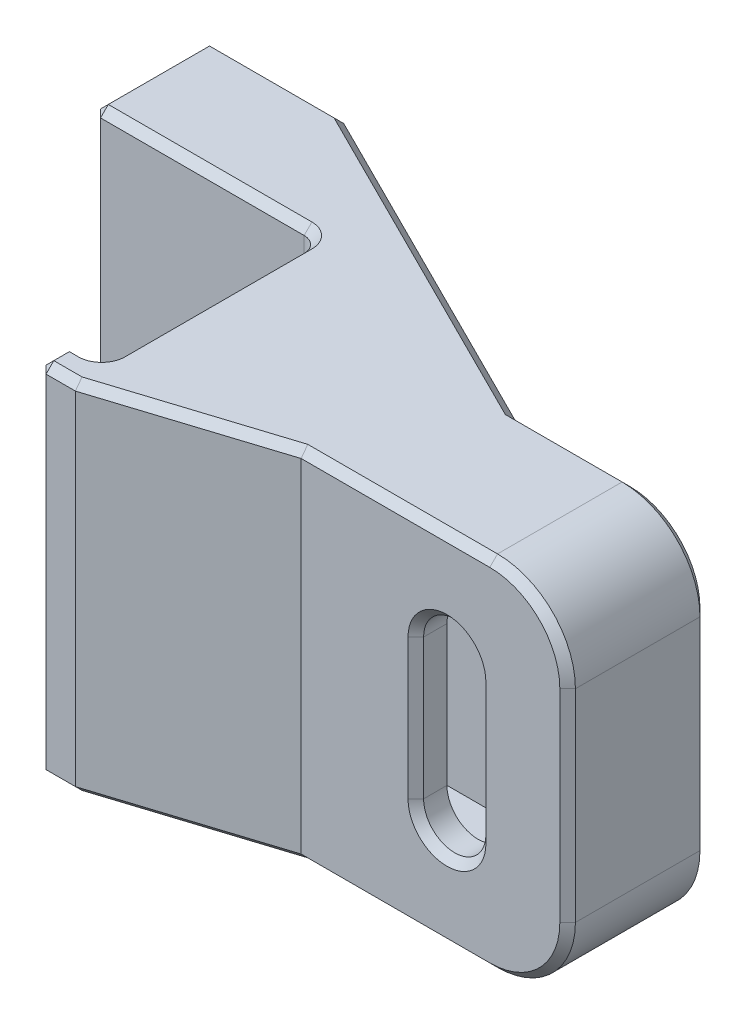
from build123d import *

# Parameters (mm, degrees)
CREATE_INTERNAL_GEOMETRY_DEPTH = 38
CUT_SHACKLE_HOLE_DEPTH         = 83.24962006
CAP_TOP_END_DEPTH              = 4
ROUND_CORNERS_R                = 10
UNNECESSARY_CHAMFERS_SIZE      = 1


with BuildPart() as part:
    # Sketch2 → Create internal geometry (new body)
    with BuildSketch(Plane(origin=(0, 0, 0), x_dir=(1, 0, 0), z_dir=(0, 1, 0))):
        Polygon((36.236067977, 20), (-7.763932023, 42), (-25, 42), (-25, 27), (4.236067977, 27), (26.236067977, 16), (57, 16), (57, 6), (26.155256109, 6), (4.155256109, -1), (0, -1), (0, -5), (4.776280544, -5), (26.776280544, 2), (61, 2), (61, 20), align=None)
    extrude(amount=CREATE_INTERNAL_GEOMETRY_DEPTH)

    # Sketch4 → Cut shackle hole (cut, through all)
    with BuildSketch(Plane.XY.offset(-2)):
        with BuildLine():
            Line((49.5, 28), (49.5, 10))
            ThreePointArc((49.5, 10), (45.5, 6), (41.5, 10))
            Line((41.5, 10), (41.5, 28))
            ThreePointArc((41.5, 28), (45.5, 32), (49.5, 28))
        make_face()
    extrude(amount=-CUT_SHACKLE_HOLE_DEPTH, mode=Mode.SUBTRACT)

    # Sketch3 → Cap top end (add)
    with BuildSketch(Plane(origin=(0, 38, 0), x_dir=(1, 0, 0), z_dir=(0, 1, 0))):
        with BuildLine():
            Line((-25, 27), (2.155256109, 27))
            ThreePointArc((2.155256109, 27), (3.569469671, 26.414213562), (4.155256109, 25))
            Line((4.155256109, 25), (4.155256109, 1))
            ThreePointArc((4.155256109, 1), (3.569469671, -0.414213562), (2.155256109, -1))
            Line((2.155256109, -1), (0, -1))
            Line((0, -1), (0, -5))
            Line((0, -5), (4.776280544, -5))
            Line((4.776280544, -5), (26.776280544, 2))
            Line((26.776280544, 2), (61, 2))
            Line((61, 2), (61, 20))
            Line((61, 20), (36.236067977, 20))
            Line((36.236067977, 20), (-7.763932023, 42))
            Line((-7.763932023, 42), (-25, 42))
            Line((-25, 42), (-25, 27))
        make_face()
    cap_top_end = extrude(amount=CAP_TOP_END_DEPTH)

    # Mirror top cap to bottom: Cap top end across plane
    add(cap_top_end.mirror(Plane.ZX.offset(19)))

    # Round corners
    round_corners_edges = [part.edges().sort_by_distance(p)[0] for p in [
        (61, 42, -11),
        (61, -4, -11),
        (57, 38, -11),
        (57, 0, -11),
    ]]
    fillet(round_corners_edges, radius=ROUND_CORNERS_R)

    # Unnecessary chamfers
    unnecessary_chamfers_edges = [part.edges().sort_by_distance(p)[0] for p in [
        (61, 19, -2),
        (61, 19, -20),
        (58.071067812, -1.071067812, -20),
        (58.071067812, -1.071067812, -2),
        (58.071067812, 39.071067812, -2),
        (58.071067812, 39.071067812, -20),
        (43.618033989, -4, -20),
        (14.236067977, -4, -31),
        (-16.381966011, -4, -42),
        (-25, -4, -34.5),
        (-11.422371946, -4, -27),
        (3.569469671, -4, -26.414213562),
        (4.155256109, -4, -13),
        (3.569469671, -4, 0.414213562),
        (1.077628054, -4, 1),
        (0, -4, 3),
        (38.888140272, -4, -2),
        (15.776280544, -4, 1.5),
        (2.388140272, -4, 5),
        (38.888140272, 42, -2),
        (15.776280544, 42, 1.5),
        (2.388140272, 42, 5),
        (0, 19, 5),
        (0, 42, 3),
        (0, 19, 1),
        (1.077628054, 42, 1),
        (3.569469671, 42, 0.414213562),
        (4.155256109, 42, -13),
        (3.569469671, 42, -26.414213562),
        (-11.422371946, 42, -27),
        (-25, 19, -27),
        (-25, 42, -34.5),
        (43.618033989, 42, -20),
        (14.236067977, 42, -31),
        (-16.381966011, 42, -42),
        (-25, 19, -42),
        (49.5, 19, -20),
        (45.5, 32, -20),
        (45.5, 6, -20),
        (41.5, 19, -20),
        (45.5, 32, -2),
        (41.5, 19, -2),
        (49.5, 19, -2),
        (45.5, 6, -2),
    ]]
    chamfer(unnecessary_chamfers_edges, length=UNNECESSARY_CHAMFERS_SIZE)


solid = part.part
